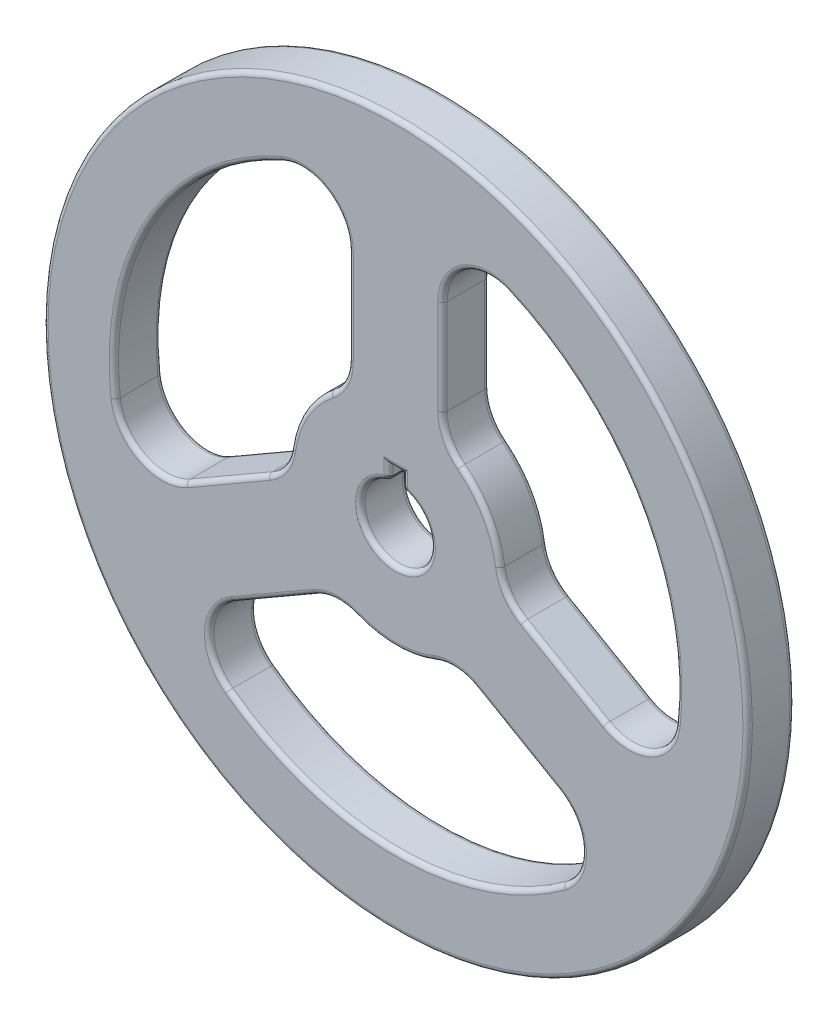
from build123d import *

# Parameters (mm, degrees)
SKETCH_1_R                       = 75
SKETCH_1_R_2                     = 7.5
EXTRUDE_1_DEPTH                  = 10
SKETCH_2_R                       = 60
SKETCH_2_R_2                     = 22.5
CUT_EXTRUDE_1_DEPTH              = 10
SKETCH_3_W                       = 20
SKETCH_3_H                       = 50.508839172
EXTRUDE_2_DEPTH                  = 10
FILLET_1_R                       = 10
PATTERN_CIRCULAR_1_COUNT         = 3
FILLET_1_OF_PATTERN_CIRCULAR_1_R = 10
SKETCH_4_W                       = 3
SKETCH_4_H                       = 6
CUT_EXTRUDE_2_DEPTH              = 10
CHAMFER_1_SIZE                   = 0.641193422
FILLET_2_R                       = 1


with BuildPart() as part:
    # 草图1 → 凸台-拉伸1 (new body)
    with BuildSketch(Plane.XY):
        Circle(SKETCH_1_R)
        Circle(SKETCH_1_R_2, mode=Mode.SUBTRACT)
    extrude(amount=EXTRUDE_1_DEPTH)

    # 草图2 → 切除-拉伸1 (cut)
    with BuildSketch(Plane.XY.offset(10)):
        Circle(SKETCH_2_R)
        Circle(SKETCH_2_R_2, mode=Mode.SUBTRACT)
    extrude(amount=-CUT_EXTRUDE_1_DEPTH, mode=Mode.SUBTRACT)


with BuildPart() as cut_extrude_1_piece_1:
    # of the separate pieces the step leaves, piece 1, a body of its own (cut_extrude_1_pieces)
    add(part.part.solids().sort_by_distance((75, 0, 0))[0])



with BuildPart() as cut_extrude_1_piece_2:
    # of the separate pieces the step leaves, piece 2, a body of its own (cut_extrude_1_pieces)
    add(part.part.solids().sort_by_distance((22.5, 0, 0))[0])


with BuildPart() as cut_extrude_1_piece_1_1:
    add(cut_extrude_1_piece_1.part)

    add(cut_extrude_1_piece_2.part)  # 凸台-拉伸2 merges 切除-拉伸1 piece 2
    # 草图3 → 凸台-拉伸2 (add)
    with BuildSketch(Plane.XY.offset(10)):
        with Locations((0, 39.378950702)):
            Rectangle(SKETCH_3_W, SKETCH_3_H)
    extrude_2 = extrude(amount=-EXTRUDE_2_DEPTH)

    # 圆角1
    fillet_1_edges = [cut_extrude_1_piece_1_1.edges().sort_by_distance(p)[0] for p in [
        (-10, 20.155644371, 5),
        (10, 20.155644371, 5),
        (-10, 59.160797831, 5),
        (10, 59.160797831, 5),
    ]]
    fillet(fillet_1_edges, radius=FILLET_1_R)

    # 阵列(圆周)1: 凸台-拉伸2 ×3 about axis
    pattern_circular_1_axis = Axis((0, 0, 0), (0, 0, 1))
    for i in range(1, PATTERN_CIRCULAR_1_COUNT):
        add(extrude_2.rotate(pattern_circular_1_axis, i * 360 / PATTERN_CIRCULAR_1_COUNT))

    # 圆角1 of 阵列(圆周)1
    fillet_1_of_pattern_circular_1_edges = [cut_extrude_1_piece_1_1.edges().sort_by_distance(p)[0] for p in [
        (-12.455300055, -18.738076223, 5),
        (-22.455300055, -1.417568148, 5),
        (-46.23475383, -38.240652953, 5),
        (-56.23475383, -20.920144878, 5),
        (22.455300055, -1.417568148, 5),
        (12.455300055, -18.738076223, 5),
        (56.23475383, -20.920144878, 5),
        (46.23475383, -38.240652953, 5),
    ]]
    fillet(fillet_1_of_pattern_circular_1_edges, radius=FILLET_1_OF_PATTERN_CIRCULAR_1_R)

    # 草图4 → 切除-拉伸2 (cut)
    with BuildSketch(Plane.XY.offset(10)):
        with Locations((0, 7.5)):
            Rectangle(SKETCH_4_W, SKETCH_4_H)
    extrude(amount=-CUT_EXTRUDE_2_DEPTH, mode=Mode.SUBTRACT)

    # 倒角1
    # the kernel refuses this chamfer: 0.641193422, 0.5 mm, written as the material it takes off along each edge
    with BuildSketch(Plane(origin=(-1.5, 7.348469228, 11.656851848), x_dir=(0, 1, 0), z_dir=(0, 0, -1))) as chamfer_1_piece_1:
        with BuildLine():
            Line((CHAMFER_1_SIZE, 0), (-0.121121804, -0.50385858))
            ThreePointArc((-0.121121804, -0.50385858), (-0.058408813, -0.262106449), (0, 0))
            Line((0, 0), (CHAMFER_1_SIZE, 0))
        make_face()
    extrude(amount=13.313703696, mode=Mode.SUBTRACT)
    with BuildSketch(Plane(origin=(1.5, 7.348469228, 11.656851848), x_dir=(0.9723015182925395, -0.233730095464881, 0), z_dir=(0, 0, -1))) as chamfer_1_piece_2:
        with BuildLine():
            Line((0.518212274, 0), (-CHAMFER_1_SIZE * 0.23373009559, -CHAMFER_1_SIZE * 0.972301518814))
            Line((-CHAMFER_1_SIZE * 0.23373009559, -CHAMFER_1_SIZE * 0.972301518814), (0, 0))
            ThreePointArc((0, 0), (0.268498395, -0.004471188), (0.518212274, 0))
        make_face()
    extrude(amount=13.313703696, mode=Mode.SUBTRACT)

    # 圆角2
    fillet_2_edges = [cut_extrude_1_piece_1_1.edges().sort_by_distance(p)[0] for p in [
        (-75, 0, 0),
        (0, -60, 10),
        (0, -60, 0),
        (-25.935784426, -26.521037504, 0),
        (-25.935784426, -26.521037504, 10),
        (-35.935784426, -9.200529428, 10),
        (-35.935784426, -9.200529428, 0),
        (0, -22.5, 10),
        (0, -22.5, 0),
        (-39.670570827, -39.673270193, 10),
        (-39.670570827, -39.673270193, 0),
        (-54.193345252, -14.519087022, 0),
        (-54.193345252, -14.519087022, 10),
        (-23.893941389, -1.078653158, 0),
        (-23.893941389, -1.078653158, 10),
        (-12.881111731, -20.15343366, 10),
        (-12.881111731, -20.15343366, 0),
        (51.961524227, 30, 0),
        (51.961524227, 30, 10),
        (35.935784426, -9.200529428, 0),
        (35.935784426, -9.200529428, 10),
        (25.935784426, -26.521037504, 10),
        (25.935784426, -26.521037504, 0),
        (19.485571585, 11.25, 0),
        (19.485571585, 11.25, 10),
        (54.193345252, -14.519087022, 10),
        (54.193345252, -14.519087022, 0),
        (39.670570827, -39.673270193, 0),
        (39.670570827, -39.673270193, 10),
        (12.881111731, -20.15343366, 0),
        (12.881111731, -20.15343366, 10),
        (23.893941389, -1.078653158, 10),
        (23.893941389, -1.078653158, 0),
        (-1.5, 9.244831325, 0),
        (0, 10.5, 0),
        (-1.5, 9.244831325, 10),
        (0, 10.5, 10),
        (1.5, 9.244831325, 10),
        (1.5, 9.244831325, 0),
        (0, -7.5, 10),
        (-1.75192929, 7.608505037, 10),
        (1.75192929, 7.608505037, 10),
        (0, -7.5, 0),
        (-1.75192929, 7.608505037, 0),
        (1.75192929, 7.608505037, 0),
        (-51.961524227, 30, 10),
        (-51.961524227, 30, 0),
        (-10, 35.721566932, 10),
        (-10, 35.721566932, 0),
        (10, 35.721566932, 0),
        (10, 35.721566932, 10),
        (-19.485571585, 11.25, 0),
        (-19.485571585, 11.25, 10),
        (-14.522774425, 54.192357215, 10),
        (-14.522774425, 54.192357215, 0),
        (14.522774425, 54.192357215, 0),
        (14.522774425, 54.192357215, 10),
        (11.012829657, 21.232086818, 10),
        (11.012829657, 21.232086818, 0),
        (-11.012829657, 21.232086818, 0),
        (-11.012829657, 21.232086818, 10),
        (-75, 0, 10),
    ]]
    fillet(fillet_2_edges, radius=FILLET_2_R)


solid = cut_extrude_1_piece_1_1.part
